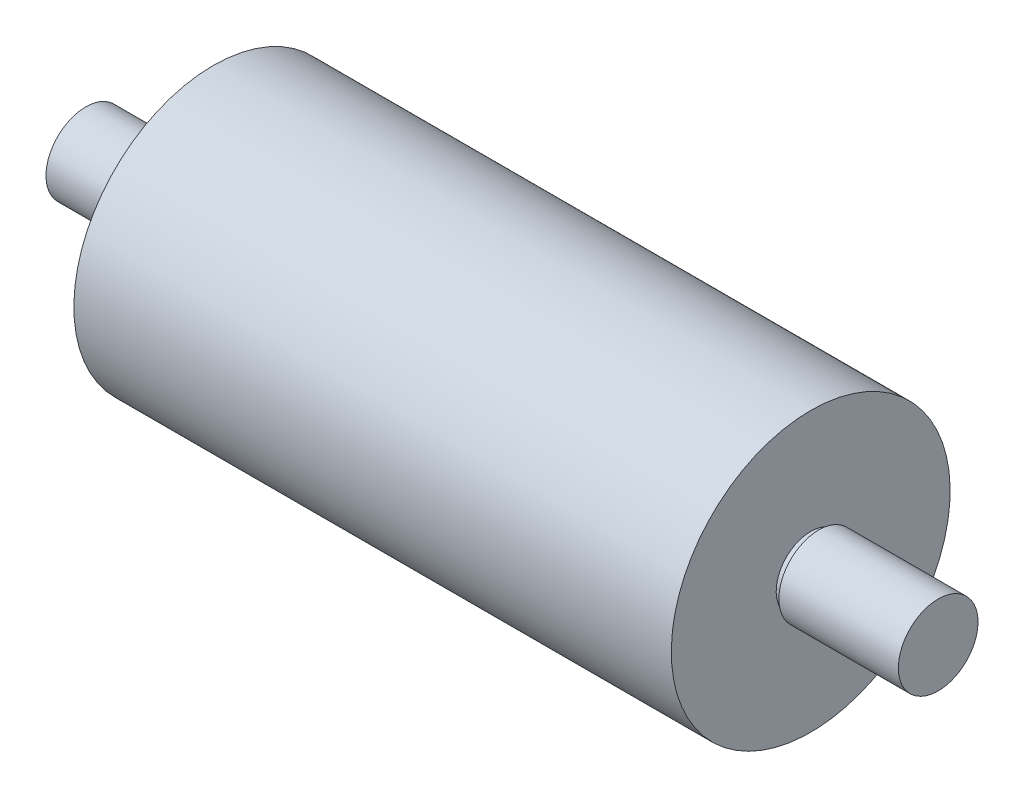
from build123d import *


with BuildPart() as part:
    # Esquisse1 → Révolution1 (revolve)
    with BuildSketch(Plane.XY):
        Polygon((0, 100), (0, 0), (2140, 0), (2140, 100), (1840, 100), (1840, 86.721336332), (1820, 86.721336332), (1820, 350), (320, 350), (320, 74.314276715), (300, 74.314276715), (300, 100), align=None)
    revolve(axis=Axis((2140, 0, 0), (-1, 0, 0)))


solid = part.part
